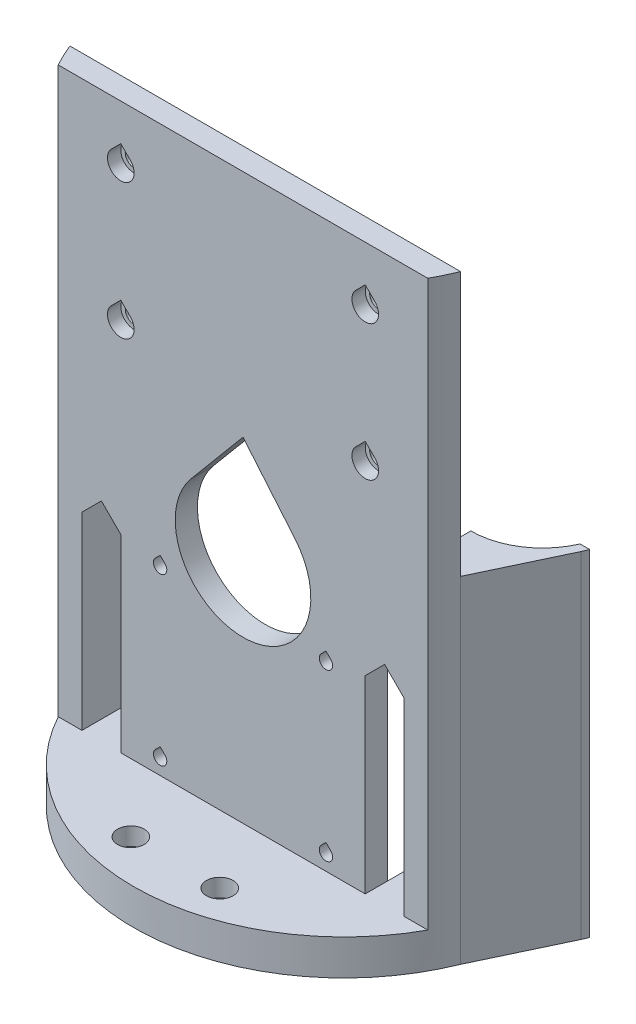
from build123d import *

# Parameters (mm, degrees)
BOSS_EXTRUDE2_DEPTH = 135
BOSS_EXTRUDE4_DEPTH = 75.6
CUT_EXTRUDE2_REACH  = 149.212
SKETCH6_W           = 72.47598603
SKETCH6_H           = 10.000044551
BOSS_EXTRUDE5_DEPTH = 8
SKETCH7_R           = 2
CUT_EXTRUDE3_DEPTH  = 15
CUT_EXTRUDE5_REACH  = 150.107
SKETCH10_R          = 3
CUT_EXTRUDE6_DEPTH  = 4
CUT_EXTRUDE7_DEPTH  = 3
CUT_EXTRUDE8_REACH  = 150.107
CUT_EXTRUDE9_REACH  = 150.107
CUT_EXTRUDE10_REACH = 147.632
SKETCH14_W          = 54.968175762
SKETCH14_H          = 10.000044551


with BuildPart() as part:
    # Sketch3 → Boss-Extrude2 (new body)
    with BuildSketch(Plane(origin=(0, 0, 0), x_dir=(1, 0, 0), z_dir=(0, 1, 0))):
        with BuildLine():
            Line((-43.942530558, -17.771156635), (43.942530558, -17.771156635))
            ThreePointArc((43.942530558, -17.771156635), (42.830309374, -20.305777476), (41.572038987, -22.771156635))
            Line((41.572038987, -22.771156635), (-41.572038987, -22.771156635))
            ThreePointArc((-41.572038987, -22.771156635), (-42.830309374, -20.305777476), (-43.942530558, -17.771156635))
        make_face()
    extrude(amount=BOSS_EXTRUDE2_DEPTH)

    # Sketch4 → Boss-Extrude4 (add)
    with BuildSketch(Plane(origin=(0, 0, 0), x_dir=(1, 0, 0), z_dir=(0, 1, 0))):
        with BuildLine():
            Line((-43.942530558, -17.771156635), (-52.653028345, 0.64823553))
            ThreePointArc((-52.653028345, 0.64823553), (-52.952588625, 1.316124168), (-53.22505003, 1.995518293))
            Line((-53.22505003, 1.995518293), (-51.067828642, 1.995518293))
            ThreePointArc((-51.067828642, 1.995518293), (-45.110255161, -5.100655996), (-36.237993015, -7.771112084))
            Line((-36.237993015, -7.771112084), (-36.237993015, -10.44821518))
            Line((-36.237993015, -10.44821518), (-36.237993015, -17.771156635))
            Line((-36.237993015, -17.771156635), (-43.942530558, -17.771156635))
        make_face()
        with BuildLine():
            Line((36.237993015, -10.44821518), (36.237993015, -7.771112084))
            ThreePointArc((36.237993015, -7.771112084), (45.110255161, -5.100655996), (51.067828642, 1.995518293))
            Line((51.067828642, 1.995518293), (53.22505003, 1.995518293))
            ThreePointArc((53.22505003, 1.995518293), (52.952588625, 1.316124168), (52.653028345, 0.64823553))
            Line((52.653028345, 0.64823553), (43.942530558, -17.771156635))
            Line((43.942530558, -17.771156635), (36.237993015, -17.771156635))
            Line((36.237993015, -17.771156635), (36.237993015, -10.44821518))
        make_face()
    extrude(amount=BOSS_EXTRUDE4_DEPTH)

    # Sketch5 → Cut-Extrude2 (cut, up to next)
    with BuildSketch(Plane.XY.offset(22.771156635), mode=Mode.PRIVATE) as cut_extrude2_sk1:
        with BuildLine():
            Line((-28.914213562, 123.864213562), (-27.5, 125.278427125))
            Line((-27.5, 125.278427125), (-26.085786438, 123.864213562))
            ThreePointArc((-26.085786438, 123.864213562), (-27.5, 120.45), (-28.914213562, 123.864213562))
        make_face()
    cut_extrude2_tool1 = extrude(cut_extrude2_sk1.sketch, amount=-CUT_EXTRUDE2_REACH, mode=Mode.PRIVATE) & part.part
    # Sketch5 → Cut-Extrude2 (cut, up to next)
    with BuildSketch(Plane.XY.offset(22.771156635), mode=Mode.PRIVATE) as cut_extrude2_sk2:
        with BuildLine():
            Line((26.085786438, 123.864213562), (27.5, 125.278427125))
            Line((27.5, 125.278427125), (28.914213562, 123.864213562))
            ThreePointArc((28.914213562, 123.864213562), (27.5, 120.45), (26.085786438, 123.864213562))
        make_face()
    cut_extrude2_tool2 = extrude(cut_extrude2_sk2.sketch, amount=-CUT_EXTRUDE2_REACH, mode=Mode.PRIVATE) & part.part
    # Sketch5 → Cut-Extrude2 (cut, up to next)
    with BuildSketch(Plane.XY.offset(22.771156635), mode=Mode.PRIVATE) as cut_extrude2_sk3:
        with BuildLine():
            Line((-28.914213562, 93.364213562), (-27.5, 94.778427125))
            Line((-27.5, 94.778427125), (-26.085786438, 93.364213562))
            ThreePointArc((-26.085786438, 93.364213562), (-27.5, 89.95), (-28.914213562, 93.364213562))
        make_face()
    cut_extrude2_tool3 = extrude(cut_extrude2_sk3.sketch, amount=-CUT_EXTRUDE2_REACH, mode=Mode.PRIVATE) & part.part
    # Sketch5 → Cut-Extrude2 (cut, up to next)
    with BuildSketch(Plane.XY.offset(22.771156635), mode=Mode.PRIVATE) as cut_extrude2_sk4:
        with BuildLine():
            Line((26.085786438, 93.364213562), (27.5, 94.778427125))
            Line((27.5, 94.778427125), (28.914213562, 93.364213562))
            ThreePointArc((28.914213562, 93.364213562), (27.5, 89.95), (26.085786438, 93.364213562))
        make_face()
    cut_extrude2_tool4 = extrude(cut_extrude2_sk4.sketch, amount=-CUT_EXTRUDE2_REACH, mode=Mode.PRIVATE) & part.part
    add(cut_extrude2_tool1.solids().sort_by_distance((-27.5, 122.590458, 22.771157))[0], mode=Mode.SUBTRACT)
    add(cut_extrude2_tool2.solids().sort_by_distance((27.5, 122.590458, 22.771157))[0], mode=Mode.SUBTRACT)
    add(cut_extrude2_tool3.solids().sort_by_distance((-27.5, 92.090458, 22.771157))[0], mode=Mode.SUBTRACT)
    add(cut_extrude2_tool4.solids().sort_by_distance((27.5, 92.090458, 22.771157))[0], mode=Mode.SUBTRACT)

    # Sketch6 → Boss-Extrude5 (add)
    with BuildSketch(Plane.XZ):
        with BuildLine():
            Line((-41.572038987, 22.771156635), (41.572038987, 22.771156635))
            ThreePointArc((41.572038987, 22.771156635), (0, 47.4), (-41.572038987, 22.771156635))
        make_face()
        with Locations((0, 12.771134359)):
            Rectangle(SKETCH6_W, SKETCH6_H)
    extrude(amount=-BOSS_EXTRUDE5_DEPTH)

    # Sketch7 → Cut-Extrude3 (cut)
    with BuildSketch(Plane(origin=(0, 8, 0), x_dir=(1, 0, 0), z_dir=(0, 1, 0))):
        with Locations((-10, -38)):
            Circle(SKETCH7_R)
        with Locations((10, -38)):
            Circle(SKETCH7_R)
        with Locations((-31.092199918, -12.771112084)):
            Circle(SKETCH7_R)
        with Locations((31.087993015, -12.771112084)):
            Circle(SKETCH7_R)
    extrude(amount=-CUT_EXTRUDE3_DEPTH, mode=Mode.SUBTRACT)

    # Sketch9 → Cut-Extrude5 (cut, up to next)
    with BuildSketch(Plane(origin=(0, 0, 17.771156635), x_dir=(-1, 0, 0), z_dir=(0, 0, -1)), mode=Mode.PRIVATE) as cut_extrude5_sk1:
        with BuildLine():
            Line((-11.686865586, 69.315706427), (0, 83.243570476))
            Line((0, 83.243570476), (11.686865586, 69.315706427))
            ThreePointArc((11.686865586, 69.315706427), (0, 44.2531423), (-11.686865586, 69.315706427))
        make_face()
    cut_extrude5_tool1 = extrude(cut_extrude5_sk1.sketch, amount=-CUT_EXTRUDE5_REACH, mode=Mode.PRIVATE) & part.part
    add(cut_extrude5_tool1.solids().sort_by_distance((0, 61.10804, 17.771157))[0], mode=Mode.SUBTRACT)

    # Sketch10 → Cut-Extrude6 (cut)
    with BuildSketch(Plane(origin=(0, 8, 0), x_dir=(1, 0, 0), z_dir=(0, 1, 0))):
        with Locations((-10, -38)):
            Circle(SKETCH10_R)
        with Locations((10, -38)):
            Circle(SKETCH10_R)
        with Locations((31.087993015, -12.771112084)):
            Circle(SKETCH10_R)
        with Locations((-31.092199918, -12.771112084)):
            Circle(SKETCH10_R)
    extrude(amount=-CUT_EXTRUDE6_DEPTH, mode=Mode.SUBTRACT)

    # Sketch11 → Cut-Extrude7 (cut)
    # profile 1 of 4: a face of its own
    with BuildSketch(Plane.XY.offset(22.771156635)):
        with BuildLine():
            Line((-27.5, 126.692640687), (-29.621320344, 124.571320344))
            ThreePointArc((-29.621320344, 124.571320344), (-27.5, 119.45), (-25.378679656, 124.571320344))
            Line((-25.378679656, 124.571320344), (-27.5, 126.692640687))
        make_face()
        with BuildLine():
            Line((-27.5, 125.278427125), (-28.914213562, 123.864213562))
            ThreePointArc((-28.914213562, 123.864213562), (-27.5, 120.45), (-26.085786438, 123.864213562))
            Line((-26.085786438, 123.864213562), (-27.5, 125.278427125))
        make_face(mode=Mode.SUBTRACT)
    # profile 2 of 4: a face of its own
    with BuildSketch(Plane.XY.offset(22.771156635)):
        with BuildLine():
            Line((27.5, 126.692640687), (25.378679656, 124.571320344))
            ThreePointArc((25.378679656, 124.571320344), (27.5, 119.45), (29.621320344, 124.571320344))
            Line((29.621320344, 124.571320344), (27.5, 126.692640687))
        make_face()
        with BuildLine():
            Line((27.5, 125.278427125), (26.085786438, 123.864213562))
            ThreePointArc((26.085786438, 123.864213562), (27.5, 120.45), (28.914213562, 123.864213562))
            Line((28.914213562, 123.864213562), (27.5, 125.278427125))
        make_face(mode=Mode.SUBTRACT)
    # profile 3 of 4: a face of its own
    with BuildSketch(Plane.XY.offset(22.771156635)):
        with BuildLine():
            Line((29.621320344, 94.071320344), (27.5, 96.192640687))
            Line((27.5, 96.192640687), (25.378679656, 94.071320344))
            ThreePointArc((25.378679656, 94.071320344), (27.5, 88.95), (29.621320344, 94.071320344))
        make_face()
        with BuildLine():
            Line((28.914213562, 93.364213562), (27.5, 94.778427125))
            Line((27.5, 94.778427125), (26.085786438, 93.364213562))
            ThreePointArc((26.085786438, 93.364213562), (27.5, 89.95), (28.914213562, 93.364213562))
        make_face(mode=Mode.SUBTRACT)
    # profile 4 of 4: a face of its own
    with BuildSketch(Plane.XY.offset(22.771156635)):
        with BuildLine():
            Line((-25.378679656, 94.071320344), (-27.5, 96.192640687))
            Line((-27.5, 96.192640687), (-29.621320344, 94.071320344))
            ThreePointArc((-29.621320344, 94.071320344), (-27.5, 88.95), (-25.378679656, 94.071320344))
        make_face()
        with BuildLine():
            Line((-26.085786438, 93.364213562), (-27.5, 94.778427125))
            Line((-27.5, 94.778427125), (-28.914213562, 93.364213562))
            ThreePointArc((-28.914213562, 93.364213562), (-27.5, 89.95), (-26.085786438, 93.364213562))
        make_face(mode=Mode.SUBTRACT)
    extrude(amount=-CUT_EXTRUDE7_DEPTH, mode=Mode.SUBTRACT)

    # Sketch12 → Cut-Extrude8 (cut, up to next)
    with BuildSketch(Plane(origin=(0, 0, 17.771156635), x_dir=(-1, 0, 0), z_dir=(0, 0, -1)), mode=Mode.PRIVATE) as cut_extrude8_sk1:
        with BuildLine():
            Line((-19.710660172, 49.860660172), (-18.65, 50.921320344))
            Line((-18.65, 50.921320344), (-17.589339828, 49.860660172))
            ThreePointArc((-17.589339828, 49.860660172), (-18.65, 47.3), (-19.710660172, 49.860660172))
        make_face()
    cut_extrude8_tool1 = extrude(cut_extrude8_sk1.sketch, amount=-CUT_EXTRUDE8_REACH, mode=Mode.PRIVATE) & part.part
    # Sketch12 → Cut-Extrude8 (cut, up to next)
    with BuildSketch(Plane(origin=(0, 0, 17.771156635), x_dir=(-1, 0, 0), z_dir=(0, 0, -1)), mode=Mode.PRIVATE) as cut_extrude8_sk2:
        with BuildLine():
            Line((17.589339828, 49.860660172), (18.65, 50.921320344))
            Line((18.65, 50.921320344), (19.710660172, 49.860660172))
            ThreePointArc((19.710660172, 49.860660172), (18.65, 47.3), (17.589339828, 49.860660172))
        make_face()
    cut_extrude8_tool2 = extrude(cut_extrude8_sk2.sketch, amount=-CUT_EXTRUDE8_REACH, mode=Mode.PRIVATE) & part.part
    # Sketch12 → Cut-Extrude8 (cut, up to next)
    with BuildSketch(Plane(origin=(0, 0, 17.771156635), x_dir=(-1, 0, 0), z_dir=(0, 0, -1)), mode=Mode.PRIVATE) as cut_extrude8_sk3:
        with BuildLine():
            Line((-19.710660172, 12.560660172), (-18.65, 13.621320344))
            Line((-18.65, 13.621320344), (-17.589339828, 12.560660172))
            ThreePointArc((-17.589339828, 12.560660172), (-18.65, 10), (-19.710660172, 12.560660172))
        make_face()
    cut_extrude8_tool3 = extrude(cut_extrude8_sk3.sketch, amount=-CUT_EXTRUDE8_REACH, mode=Mode.PRIVATE) & part.part
    # Sketch12 → Cut-Extrude8 (cut, up to next)
    with BuildSketch(Plane(origin=(0, 0, 17.771156635), x_dir=(-1, 0, 0), z_dir=(0, 0, -1)), mode=Mode.PRIVATE) as cut_extrude8_sk4:
        with BuildLine():
            Line((17.589339828, 12.560660172), (18.65, 13.621320344))
            Line((18.65, 13.621320344), (19.710660172, 12.560660172))
            ThreePointArc((19.710660172, 12.560660172), (18.65, 10), (17.589339828, 12.560660172))
        make_face()
    cut_extrude8_tool4 = extrude(cut_extrude8_sk4.sketch, amount=-CUT_EXTRUDE8_REACH, mode=Mode.PRIVATE) & part.part
    add(cut_extrude8_tool1.solids().sort_by_distance((18.65, 48.905344, 17.771157))[0], mode=Mode.SUBTRACT)
    add(cut_extrude8_tool2.solids().sort_by_distance((-18.65, 48.905344, 17.771157))[0], mode=Mode.SUBTRACT)
    add(cut_extrude8_tool3.solids().sort_by_distance((18.65, 11.605344, 17.771157))[0], mode=Mode.SUBTRACT)
    add(cut_extrude8_tool4.solids().sort_by_distance((-18.65, 11.605344, 17.771157))[0], mode=Mode.SUBTRACT)

    # Sketch13 → Cut-Extrude9 (cut, up to next)
    with BuildSketch(Plane(origin=(0, 0, 17.771156635), x_dir=(-1, 0, 0), z_dir=(0, 0, -1)), mode=Mode.PRIVATE) as cut_extrude9_sk1:
        Polygon((-36.237993015, 50.526757846), (-36.237993015, 8), (-27.484087881, 8), (-27.484087881, 50.526757846), (-31.861040448, 54.903710412), align=None)
    cut_extrude9_tool1 = extrude(cut_extrude9_sk1.sketch, amount=-CUT_EXTRUDE9_REACH, mode=Mode.PRIVATE) & part.part
    # Sketch13 → Cut-Extrude9 (cut, up to next)
    with BuildSketch(Plane(origin=(0, 0, 17.771156635), x_dir=(-1, 0, 0), z_dir=(0, 0, -1)), mode=Mode.PRIVATE) as cut_extrude9_sk2:
        Polygon((31.861040448, 54.903710412), (36.237993015, 50.526757846), (36.237993015, 8), (27.484087881, 8), (27.484087881, 50.526757846), align=None)
    cut_extrude9_tool2 = extrude(cut_extrude9_sk2.sketch, amount=-CUT_EXTRUDE9_REACH, mode=Mode.PRIVATE) & part.part
    add(cut_extrude9_tool1.solids().sort_by_distance((31.86104, 30.375469, 17.771157))[0], mode=Mode.SUBTRACT)
    add(cut_extrude9_tool2.solids().sort_by_distance((-31.86104, 30.375469, 17.771157))[0], mode=Mode.SUBTRACT)

    # Sketch14 → Cut-Extrude10 (cut, up to next)
    with BuildSketch(Plane(origin=(0, 8, 0), x_dir=(1, 0, 0), z_dir=(0, 1, 0)), mode=Mode.PRIVATE) as cut_extrude10_sk1:
        with Locations((0, -12.771134359)):
            Rectangle(SKETCH14_W, SKETCH14_H)
    cut_extrude10_tool1 = extrude(cut_extrude10_sk1.sketch, amount=-CUT_EXTRUDE10_REACH, mode=Mode.PRIVATE) & part.part
    add(cut_extrude10_tool1.solids().sort_by_distance((0, 8, 12.771134))[0], mode=Mode.SUBTRACT)


solid = part.part
